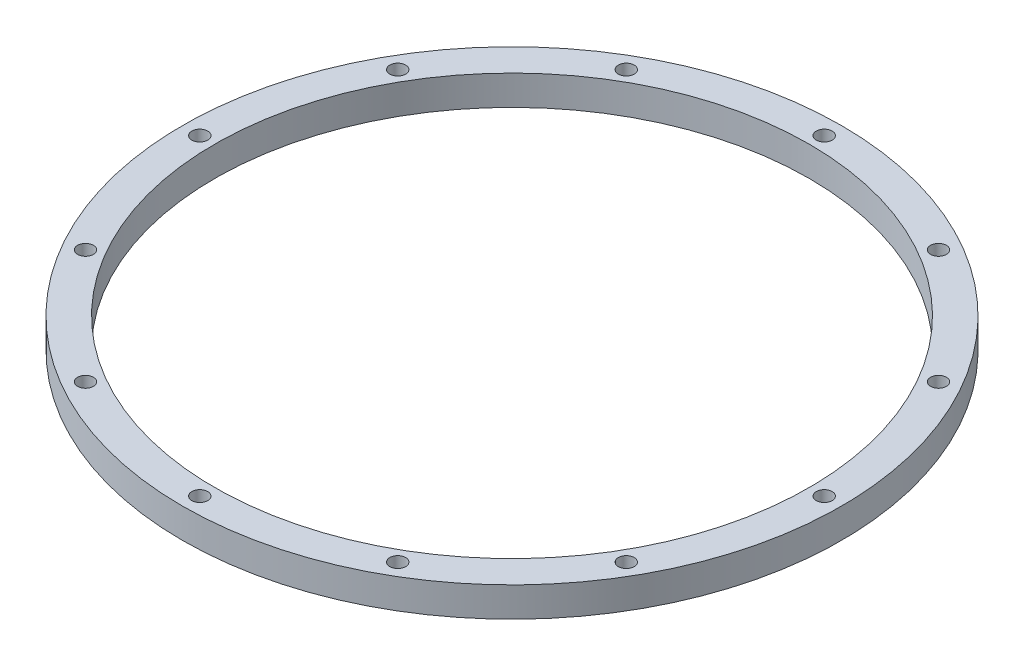
from build123d import *

# Parameters (mm, degrees)
SKETCH1_W          = 6.5
SKETCH1_H          = 6
SKETCH2_R          = 1.6
CUT_EXTRUDE1_DEPTH = 95.236404855
CIRPATTERN1_COUNT  = 12


with BuildPart() as part:
    # Sketch1 → Revolve1 (revolve)
    with BuildSketch(Plane.XY):
        with Locations((-63.25, 3.785)):
            Rectangle(SKETCH1_W, SKETCH1_H)
    revolve(axis=Axis((0, -200069.047495165, 0), (0, 1, 0)))

    # Sketch2 → Cut-Extrude1 (cut, through all)
    with BuildSketch(Plane(origin=(0, 6.785, 0), x_dir=(1, 0, 0), z_dir=(0, 1, 0))):
        with Locations((0, 63)):
            Circle(SKETCH2_R)
    cut_extrude1 = extrude(amount=-CUT_EXTRUDE1_DEPTH, mode=Mode.SUBTRACT)

    # CirPattern1: Cut-Extrude1 ×12 about axis
    cirpattern1_axis = Axis((0, -200069.047495165, 0), (0, -1, 0))
    for i in range(1, CIRPATTERN1_COUNT):
        add(cut_extrude1.rotate(cirpattern1_axis, i * 360 / CIRPATTERN1_COUNT), mode=Mode.SUBTRACT)


solid = part.part
